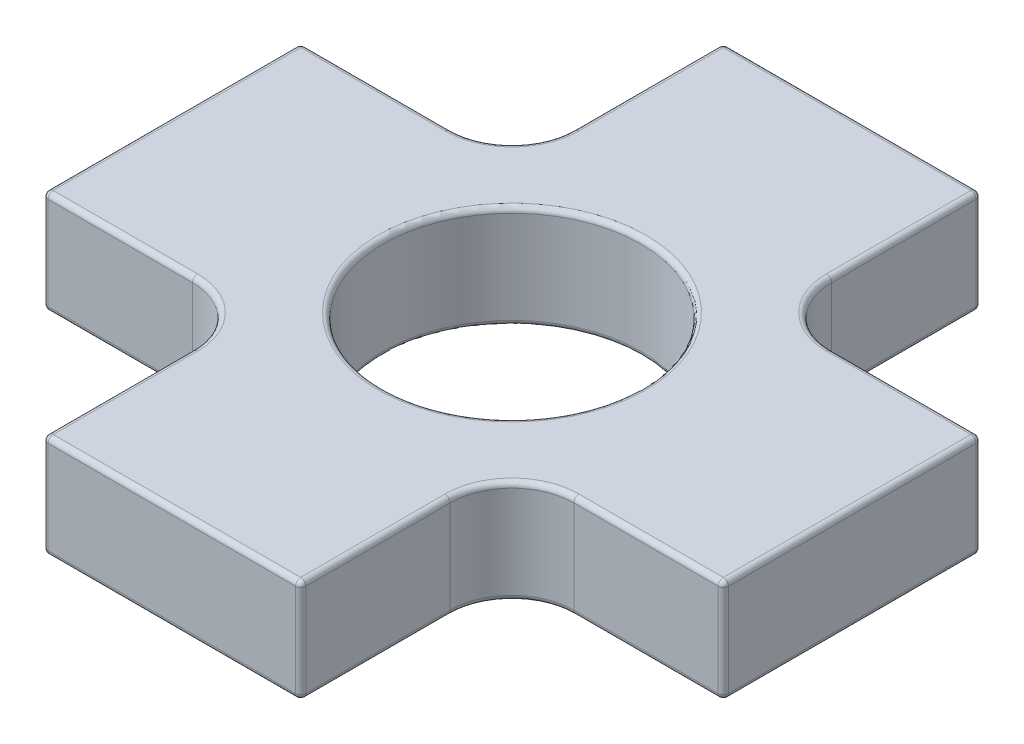
from build123d import *

# Parameters (mm, degrees)
EXTRUDE_1_DEPTH     = 5
SKETCH_2_R          = 6.25
CUT_EXTRUDE_1_DEPTH = 5
FILLET_1_R          = 3
FILLET_2_R          = 0.25
FILLET_3_R          = 0.25


with BuildPart() as part:
    # 草图1 → 凸台-拉伸1 (new body)
    with BuildSketch(Plane(origin=(0, 0, 0), x_dir=(1, 0, 0), z_dir=(0, 1, 0))):
        Polygon((6.25, 6.25), (16.5, 6.25), (16.5, -6.25), (6.25, -6.25), (6.25, -16.5), (-6.25, -16.5), (-6.25, -6.25), (-16.5, -6.25), (-16.5, 6.25), (-6.25, 6.25), (-6.25, 16.5), (6.25, 16.5), align=None)
    extrude(amount=EXTRUDE_1_DEPTH)

    # 草图2 → 切除-拉伸1 (cut)
    with BuildSketch(Plane(origin=(0, 5, 0), x_dir=(1, 0, 0), z_dir=(0, 1, 0))):
        with Locations(Location((0, 0, 0), (0, 0, 270))):
            Circle(SKETCH_2_R)
    extrude(amount=-CUT_EXTRUDE_1_DEPTH, mode=Mode.SUBTRACT)

    # 圆角1
    fillet_1_edges = [part.edges().sort_by_distance(p)[0] for p in [
        (6.25, 2.5, -6.25),
        (6.25, 2.5, 6.25),
        (-6.25, 2.5, 6.25),
        (-6.25, 2.5, -6.25),
    ]]
    fillet(fillet_1_edges, radius=FILLET_1_R)

    # 圆角2
    fillet_2_edges = [part.edges().sort_by_distance(p)[0] for p in [
        (12.875, 0, -6.25),
        (16.5, 0, 0),
        (-6.25, 5, -12.875),
        (6.25, 0, 12.875),
        (0, 0, 16.5),
        (-12.875, 0, 6.25),
        (-16.5, 0, 0),
        (-6.25, 0, -12.875),
        (0, 0, -16.5),
        (-16.5, 5, 0),
        (-12.875, 5, 6.25),
        (0, 5, 16.5),
        (6.25, 5, 12.875),
        (0, 0, -6.25),
        (0, 5, -6.25),
        (12.875, 0, 6.25),
        (12.875, 5, 6.25),
        (-6.25, 0, 12.875),
        (-6.25, 5, 12.875),
        (16.5, 5, 0),
        (-12.875, 0, -6.25),
        (-12.875, 5, -6.25),
        (6.25, 0, -12.875),
        (6.25, 5, -12.875),
        (12.875, 5, -6.25),
        (7.128679656, 0, 7.128679656),
        (7.128679656, 5, 7.128679656),
        (-7.128679656, 0, 7.128679656),
        (-7.128679656, 5, 7.128679656),
        (-7.128679656, 0, -7.128679656),
        (-7.128679656, 5, -7.128679656),
        (7.128679656, 0, -7.128679656),
        (7.128679656, 5, -7.128679656),
        (0, 5, -16.5),
    ]]
    fillet(fillet_2_edges, radius=FILLET_2_R)

    # 圆角3
    # the kernel refuses this fillet: 0.25 mm, written as the material it takes off along each edge
    with BuildSketch(Plane(origin=(6, 0.25, 16.25), x_dir=(0, 0, 1), z_dir=(1, 0, 0))) as fillet_3_piece_1_section:
        Polygon((0, 0), (FILLET_3_R, 0), (FILLET_3_R, FILLET_3_R), (0, FILLET_3_R), align=None)
    fillet_3_piece_1 = extrude(amount=FILLET_3_R, mode=Mode.PRIVATE)
    fillet_3_piece_1 = fillet_3_piece_1 - Plane(origin=(6, 0.25, 16.25), x_dir=(0, 0.7071067811865475, -0.7071067811865475), z_dir=(1, 0, 0)) * Sphere(FILLET_3_R, mode=Mode.PRIVATE)
    add(fillet_3_piece_1, mode=Mode.SUBTRACT)
    with BuildSketch(Plane(origin=(-6, 0.25, 16.25), x_dir=(-1, 0, 0), z_dir=(0, 0, 1))) as fillet_3_piece_2_section:
        Polygon((0, 0), (FILLET_3_R, 0), (FILLET_3_R, FILLET_3_R), (0, FILLET_3_R), align=None)
    fillet_3_piece_2 = extrude(amount=FILLET_3_R, mode=Mode.PRIVATE)
    fillet_3_piece_2 = fillet_3_piece_2 - Plane(origin=(-6, 0.25, 16.25), x_dir=(0.7071067811865475, 0.7071067811865475, 0), z_dir=(0, 0, 1)) * Sphere(FILLET_3_R, mode=Mode.PRIVATE)
    add(fillet_3_piece_2, mode=Mode.SUBTRACT)
    with BuildSketch(Plane(origin=(16.25, 0.25, 6), x_dir=(0, 0, 1), z_dir=(1, 0, 0))) as fillet_3_piece_3_section:
        Polygon((0, 0), (FILLET_3_R, 0), (FILLET_3_R, FILLET_3_R), (0, FILLET_3_R), align=None)
    fillet_3_piece_3 = extrude(amount=FILLET_3_R, mode=Mode.PRIVATE)
    fillet_3_piece_3 = fillet_3_piece_3 - Plane(origin=(16.25, 0.25, 6), x_dir=(0, 0.7071067811865475, -0.7071067811865475), z_dir=(1, 0, 0)) * Sphere(FILLET_3_R, mode=Mode.PRIVATE)
    add(fillet_3_piece_3, mode=Mode.SUBTRACT)
    with BuildSketch(Plane(origin=(-16.25, 0.25, 6), x_dir=(0, 0, 1), z_dir=(-1, 0, 0))) as fillet_3_piece_4_section:
        Polygon((0, 0), (FILLET_3_R, 0), (FILLET_3_R, -FILLET_3_R), (0, -FILLET_3_R), align=None)
    fillet_3_piece_4 = extrude(amount=FILLET_3_R, mode=Mode.PRIVATE)
    fillet_3_piece_4 = fillet_3_piece_4 - Plane(origin=(-16.25, 0.25, 6), x_dir=(0, 0.7071067811865475, -0.7071067811865475), z_dir=(-1, 0, 0)) * Sphere(FILLET_3_R, mode=Mode.PRIVATE)
    add(fillet_3_piece_4, mode=Mode.SUBTRACT)
    with BuildSketch(Plane(origin=(16.25, 0.25, -6), x_dir=(1, 0, 0), z_dir=(0, 0, -1))) as fillet_3_piece_5_section:
        Polygon((0, 0), (FILLET_3_R, 0), (FILLET_3_R, FILLET_3_R), (0, FILLET_3_R), align=None)
    fillet_3_piece_5 = extrude(amount=FILLET_3_R, mode=Mode.PRIVATE)
    fillet_3_piece_5 = fillet_3_piece_5 - Plane(origin=(16.25, 0.25, -6), x_dir=(-0.7071067811865475, 0.7071067811865475, 0), z_dir=(0, 0, -1)) * Sphere(FILLET_3_R, mode=Mode.PRIVATE)
    add(fillet_3_piece_5, mode=Mode.SUBTRACT)
    with BuildSketch(Plane(origin=(-16.25, 0.25, -6), x_dir=(-1, 0, 0), z_dir=(0, 0, -1))) as fillet_3_piece_6_section:
        Polygon((0, 0), (FILLET_3_R, 0), (FILLET_3_R, -FILLET_3_R), (0, -FILLET_3_R), align=None)
    fillet_3_piece_6 = extrude(amount=FILLET_3_R, mode=Mode.PRIVATE)
    fillet_3_piece_6 = fillet_3_piece_6 - Plane(origin=(-16.25, 0.25, -6), x_dir=(0.7071067811865475, 0.7071067811865475, 0), z_dir=(0, 0, -1)) * Sphere(FILLET_3_R, mode=Mode.PRIVATE)
    add(fillet_3_piece_6, mode=Mode.SUBTRACT)
    with BuildSketch(Plane(origin=(6, 0.25, -16.25), x_dir=(0, 0, -1), z_dir=(1, 0, 0))) as fillet_3_piece_7_section:
        Polygon((0, 0), (FILLET_3_R, 0), (FILLET_3_R, -FILLET_3_R), (0, -FILLET_3_R), align=None)
    fillet_3_piece_7 = extrude(amount=FILLET_3_R, mode=Mode.PRIVATE)
    fillet_3_piece_7 = fillet_3_piece_7 - Plane(origin=(6, 0.25, -16.25), x_dir=(0, 0.7071067811865475, 0.7071067811865475), z_dir=(1, 0, 0)) * Sphere(FILLET_3_R, mode=Mode.PRIVATE)
    add(fillet_3_piece_7, mode=Mode.SUBTRACT)
    with BuildSketch(Plane(origin=(-6, 0.25, -16.25), x_dir=(-1, 0, 0), z_dir=(0, 0, -1))) as fillet_3_piece_8_section:
        Polygon((0, 0), (FILLET_3_R, 0), (FILLET_3_R, -FILLET_3_R), (0, -FILLET_3_R), align=None)
    fillet_3_piece_8 = extrude(amount=FILLET_3_R, mode=Mode.PRIVATE)
    fillet_3_piece_8 = fillet_3_piece_8 - Plane(origin=(-6, 0.25, -16.25), x_dir=(0.7071067811865475, 0.7071067811865475, 0), z_dir=(0, 0, -1)) * Sphere(FILLET_3_R, mode=Mode.PRIVATE)
    add(fillet_3_piece_8, mode=Mode.SUBTRACT)
    with BuildSketch(Plane(origin=(-16.25, 4.75, 6), x_dir=(0, 0, 1), z_dir=(-1, 0, 0))) as fillet_3_piece_9_section:
        Polygon((0, 0), (FILLET_3_R, 0), (FILLET_3_R, FILLET_3_R), (0, FILLET_3_R), align=None)
    fillet_3_piece_9 = extrude(amount=FILLET_3_R, mode=Mode.PRIVATE)
    fillet_3_piece_9 = fillet_3_piece_9 - Plane(origin=(-16.25, 4.75, 6), x_dir=(0, -0.7071067811865475, -0.7071067811865475), z_dir=(-1, 0, 0)) * Sphere(FILLET_3_R, mode=Mode.PRIVATE)
    add(fillet_3_piece_9, mode=Mode.SUBTRACT)
    with BuildSketch(Plane(origin=(-16.25, 4.75, -6), x_dir=(-1, 0, 0), z_dir=(0, 0, -1))) as fillet_3_piece_10_section:
        Polygon((0, 0), (FILLET_3_R, 0), (FILLET_3_R, FILLET_3_R), (0, FILLET_3_R), align=None)
    fillet_3_piece_10 = extrude(amount=FILLET_3_R, mode=Mode.PRIVATE)
    fillet_3_piece_10 = fillet_3_piece_10 - Plane(origin=(-16.25, 4.75, -6), x_dir=(0.7071067811865475, -0.7071067811865475, 0), z_dir=(0, 0, -1)) * Sphere(FILLET_3_R, mode=Mode.PRIVATE)
    add(fillet_3_piece_10, mode=Mode.SUBTRACT)
    with BuildSketch(Plane(origin=(-6, 4.75, 16.25), x_dir=(-1, 0, 0), z_dir=(0, 0, 1))) as fillet_3_piece_11_section:
        Polygon((0, 0), (FILLET_3_R, 0), (FILLET_3_R, -FILLET_3_R), (0, -FILLET_3_R), align=None)
    fillet_3_piece_11 = extrude(amount=FILLET_3_R, mode=Mode.PRIVATE)
    fillet_3_piece_11 = fillet_3_piece_11 - Plane(origin=(-6, 4.75, 16.25), x_dir=(0.7071067811865475, -0.7071067811865475, 0), z_dir=(0, 0, 1)) * Sphere(FILLET_3_R, mode=Mode.PRIVATE)
    add(fillet_3_piece_11, mode=Mode.SUBTRACT)
    with BuildSketch(Plane(origin=(-6, 4.75, -16.25), x_dir=(-1, 0, 0), z_dir=(0, 0, -1))) as fillet_3_piece_12_section:
        Polygon((0, 0), (FILLET_3_R, 0), (FILLET_3_R, FILLET_3_R), (0, FILLET_3_R), align=None)
    fillet_3_piece_12 = extrude(amount=FILLET_3_R, mode=Mode.PRIVATE)
    fillet_3_piece_12 = fillet_3_piece_12 - Plane(origin=(-6, 4.75, -16.25), x_dir=(0.7071067811865475, -0.7071067811865475, 0), z_dir=(0, 0, -1)) * Sphere(FILLET_3_R, mode=Mode.PRIVATE)
    add(fillet_3_piece_12, mode=Mode.SUBTRACT)
    with BuildSketch(Plane(origin=(6, 4.75, 16.25), x_dir=(0, 0, 1), z_dir=(1, 0, 0))) as fillet_3_piece_13_section:
        Polygon((0, 0), (FILLET_3_R, 0), (FILLET_3_R, -FILLET_3_R), (0, -FILLET_3_R), align=None)
    fillet_3_piece_13 = extrude(amount=FILLET_3_R, mode=Mode.PRIVATE)
    fillet_3_piece_13 = fillet_3_piece_13 - Plane(origin=(6, 4.75, 16.25), x_dir=(0, -0.7071067811865475, -0.7071067811865475), z_dir=(1, 0, 0)) * Sphere(FILLET_3_R, mode=Mode.PRIVATE)
    add(fillet_3_piece_13, mode=Mode.SUBTRACT)
    with BuildSketch(Plane(origin=(6, 4.75, -16.25), x_dir=(0, 0, -1), z_dir=(1, 0, 0))) as fillet_3_piece_14_section:
        Polygon((0, 0), (FILLET_3_R, 0), (FILLET_3_R, FILLET_3_R), (0, FILLET_3_R), align=None)
    fillet_3_piece_14 = extrude(amount=FILLET_3_R, mode=Mode.PRIVATE)
    fillet_3_piece_14 = fillet_3_piece_14 - Plane(origin=(6, 4.75, -16.25), x_dir=(0, -0.7071067811865475, 0.7071067811865475), z_dir=(1, 0, 0)) * Sphere(FILLET_3_R, mode=Mode.PRIVATE)
    add(fillet_3_piece_14, mode=Mode.SUBTRACT)
    with BuildSketch(Plane(origin=(16.25, 4.75, 6), x_dir=(0, 0, 1), z_dir=(1, 0, 0))) as fillet_3_piece_15_section:
        Polygon((0, 0), (FILLET_3_R, 0), (FILLET_3_R, -FILLET_3_R), (0, -FILLET_3_R), align=None)
    fillet_3_piece_15 = extrude(amount=FILLET_3_R, mode=Mode.PRIVATE)
    fillet_3_piece_15 = fillet_3_piece_15 - Plane(origin=(16.25, 4.75, 6), x_dir=(0, -0.7071067811865475, -0.7071067811865475), z_dir=(1, 0, 0)) * Sphere(FILLET_3_R, mode=Mode.PRIVATE)
    add(fillet_3_piece_15, mode=Mode.SUBTRACT)
    with BuildSketch(Plane(origin=(16.25, 4.75, -6), x_dir=(1, 0, 0), z_dir=(0, 0, -1))) as fillet_3_piece_16_section:
        Polygon((0, 0), (FILLET_3_R, 0), (FILLET_3_R, -FILLET_3_R), (0, -FILLET_3_R), align=None)
    fillet_3_piece_16 = extrude(amount=FILLET_3_R, mode=Mode.PRIVATE)
    fillet_3_piece_16 = fillet_3_piece_16 - Plane(origin=(16.25, 4.75, -6), x_dir=(-0.7071067811865475, -0.7071067811865475, 0), z_dir=(0, 0, -1)) * Sphere(FILLET_3_R, mode=Mode.PRIVATE)
    add(fillet_3_piece_16, mode=Mode.SUBTRACT)
    with BuildSketch(Plane(origin=(-6.25, 0.25, -16.5), x_dir=(1, 0, 0), z_dir=(0, 1, 0)), Plane(origin=(6.25, 0.25, -16.5), x_dir=(0, 0, 1), z_dir=(0, 1, 0)), Plane(origin=(-16.5, 0.25, -6.25), x_dir=(1, 0, 0), z_dir=(0, 1, 0)), Plane(origin=(-16.5, 0.25, 6.25), x_dir=(0, 0, -1), z_dir=(0, 1, 0))) as fillet_3_piece_17:
        with BuildLine():
            CenterArc((FILLET_3_R, -FILLET_3_R), FILLET_3_R, 90, 90)
            Line((0, -FILLET_3_R), (0, 0))
            Line((0, 0), (FILLET_3_R, 0))
        make_face()
    extrude(amount=4.5, mode=Mode.SUBTRACT)
    with BuildSketch(Plane(origin=(-6.25, 0.25, 16.5), x_dir=(1, 0, 0), z_dir=(0, 1, 0)), Plane(origin=(6.25, 0.25, 16.5), x_dir=(0, 0, -1), z_dir=(0, 1, 0)), Plane(origin=(16.5, 0.25, 6.25), x_dir=(0, 0, -1), z_dir=(0, 1, 0)), Plane(origin=(16.5, 0.25, -6.25), x_dir=(-1, 0, 0), z_dir=(0, 1, 0))) as fillet_3_piece_18:
        with BuildLine():
            CenterArc((FILLET_3_R, FILLET_3_R), FILLET_3_R, 180, 90)
            Line((0, FILLET_3_R), (0, 0))
            Line((0, 0), (FILLET_3_R, 0))
        make_face()
    extrude(amount=4.5, mode=Mode.SUBTRACT)


solid = part.part
